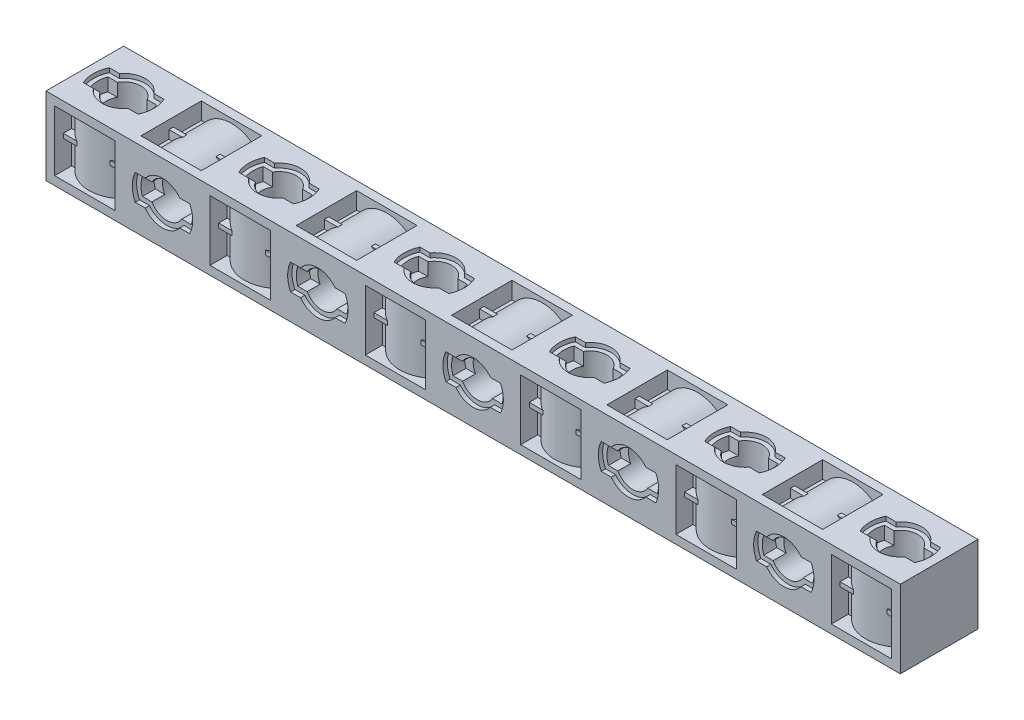
from build123d import *

# Parameters (mm, degrees)
SKETCH1_W                 = 99
SKETCH1_H                 = 9
BOSS_EXTRUDE1_DEPTH       = 4.5
SKETCH4_R                 = 2
CUT_EXTRUDE1_DEPTH        = 50.907414279
CUT_EXTRUDE2_DEPTH        = 2
CUT_EXTRUDE3_DEPTH        = 0.5
SKETCH8_R                 = 2
CUT_EXTRUDE4_DEPTH        = 50.907414279
CUT_EXTRUDE5_DEPTH        = 2
CUT_EXTRUDE6_DEPTH        = 0.5
SKETCH_PATTERN1_START     = -5
SKETCH_PATTERN1_OUTLINE_R = 2
SKETCH_PATTERN1_DEPTH     = 10
SKETCH_PATTERN1_2_DEPTH   = 2.5
SKETCH_PATTERN1_START_2   = 2.5
SKETCH_PATTERN1_3_DEPTH   = 2.5
SKETCH_PATTERN1_4_DEPTH   = 1
SKETCH_PATTERN1_START_3   = 4
SKETCH_PATTERN1_5_DEPTH   = 1
SKETCH_PATTERN2_START     = -4.5
SKETCH_PATTERN2_OUTLINE_R = 2
SKETCH_PATTERN2_DEPTH     = 9
SKETCH_PATTERN2_2_DEPTH   = 2
SKETCH_PATTERN2_START_2   = 2.5
SKETCH_PATTERN2_3_DEPTH   = 2
SKETCH_PATTERN2_4_DEPTH   = 0.5
SKETCH_PATTERN2_START_3   = 4
SKETCH_PATTERN2_5_DEPTH   = 0.5
CUT_EXTRUDE7_DEPTH        = 3.5
CUT_EXTRUDE8_DEPTH        = 3.5
RIB3_START                = -0.972155068
RIB3_OUTLINE_W            = 7
RIB3_OUTLINE_H            = 0.5
RIB3_DEPTH                = 0.972155068
SKETCH_PATTERN13_START    = -0.25
SKETCH_PATTERN13_DEPTH    = 0.5
RIB5_START                = -0.972155068
RIB5_OUTLINE_W            = 7
RIB5_OUTLINE_H            = 0.5
RIB5_DEPTH                = 0.972155068
SKETCH_PATTERN16_START    = -0.25
SKETCH_PATTERN16_DEPTH    = 0.5


with BuildPart() as part:
    # Sketch1 → Boss-Extrude1 (new, symmetric)
    with BuildSketch(Plane(origin=(0, 0, 0), x_dir=(1, 0, 0), z_dir=(0, 1, 0))):
        Rectangle(SKETCH1_W, SKETCH1_H)
    extrude(amount=BOSS_EXTRUDE1_DEPTH, both=True)

    # Sketch4 → Cut-Extrude1 (cut, symmetric)
    with BuildSketch(Plane(origin=(0, 0, 0), x_dir=(1, 0, 0), z_dir=(0, 1, 0))):
        with Locations(Location((-45, 0, 0), (0, 0, 270))):
            Circle(SKETCH4_R)
    extrude(amount=CUT_EXTRUDE1_DEPTH, both=True, mode=Mode.SUBTRACT)

    # Sketch5 → Cut-Extrude2 (cut)
    with BuildSketch(Plane(origin=(0, 4.5, 0), x_dir=(1, 0, 0), z_dir=(0, 1, 0))):
        with BuildLine():
            ThreePointArc((-48, 0), (-47.956795679, -0.507305936), (-47.828427125, -1))
            Line((-47.828427125, -1), (-46.732050808, -1))
            ThreePointArc((-46.732050808, -1), (-47, 0), (-46.732050808, 1))
            Line((-46.732050808, 1), (-47.828427125, 1))
            ThreePointArc((-47.828427125, 1), (-47.956795679, 0.507305936), (-48, 0))
        make_face()
        with BuildLine():
            Line((-43.267949192, -1), (-42.171572875, -1))
            ThreePointArc((-42.171572875, -1), (-42.043204321, -0.507305936), (-42, 0))
            ThreePointArc((-42, 0), (-42.043204321, 0.507305936), (-42.171572875, 1))
            Line((-42.171572875, 1), (-43.267949192, 1))
            ThreePointArc((-43.267949192, 1), (-43.068148347, 0.51763809), (-43, 0))
            ThreePointArc((-43, 0), (-43.068148347, -0.51763809), (-43.267949192, -1))
        make_face()
        with BuildLine():
            ThreePointArc((-46.732050808, 1), (-47, 0), (-46.732050808, -1))
            Line((-46.732050808, -1), (-43.267949192, -1))
            ThreePointArc((-43.267949192, -1), (-43.068148347, -0.51763809), (-43, 0))
            ThreePointArc((-43, 0), (-43.068148347, 0.51763809), (-43.267949192, 1))
            Line((-43.267949192, 1), (-46.732050808, 1))
        make_face()
    cut_extrude2 = extrude(amount=-CUT_EXTRUDE2_DEPTH, mode=Mode.SUBTRACT)

    # Sketch6 → Cut-Extrude3 (cut)
    with BuildSketch(Plane(origin=(0, 4.5, 0), x_dir=(1, 0, 0), z_dir=(0, 1, 0))):
        with BuildLine():
            Line((-48.16227766, 1.5), (-47, 1.5))
            ThreePointArc((-47, 1.5), (-45, 2.5), (-43, 1.5))
            Line((-43, 1.5), (-41.83772234, 1.5))
            ThreePointArc((-41.83772234, 1.5), (-41.5, 0), (-41.83772234, -1.5))
            Line((-41.83772234, -1.5), (-43, -1.5))
            ThreePointArc((-43, -1.5), (-45, -2.5), (-47, -1.5))
            Line((-47, -1.5), (-48.16227766, -1.5))
            ThreePointArc((-48.16227766, -1.5), (-48.5, 0), (-48.16227766, 1.5))
        make_face()
        with BuildLine():
            Line((-43.267949192, -1), (-42.171572875, -1))
            ThreePointArc((-42.171572875, -1), (-42, 0), (-42.171572875, 1))
            Line((-42.171572875, 1), (-43.267949192, 1))
            ThreePointArc((-43.267949192, 1), (-45, 2), (-46.732050808, 1))
            Line((-46.732050808, 1), (-47.828427125, 1))
            ThreePointArc((-47.828427125, 1), (-48, 0), (-47.828427125, -1))
            Line((-47.828427125, -1), (-46.732050808, -1))
            ThreePointArc((-46.732050808, -1), (-45, -2), (-43.267949192, -1))
        make_face(mode=Mode.SUBTRACT)
    cut_extrude3 = extrude(amount=-CUT_EXTRUDE3_DEPTH, mode=Mode.SUBTRACT)

    # Mirror1: Cut-Extrude2, Cut-Extrude3 across plane
    add(cut_extrude2.mirror(Plane.ZX), mode=Mode.SUBTRACT)
    add(cut_extrude3.mirror(Plane.ZX), mode=Mode.SUBTRACT)

    # Sketch8 → Cut-Extrude4 (cut, symmetric)
    with BuildSketch(Plane.XY):
        with Locations((-36, 0)):
            Circle(SKETCH8_R)
    extrude(amount=CUT_EXTRUDE4_DEPTH, both=True, mode=Mode.SUBTRACT)

    # Sketch9 → Cut-Extrude5 (cut)
    with BuildSketch(Plane.XY.offset(4.5)):
        with BuildLine():
            ThreePointArc((-39, 0), (-38.956795679, -0.507305936), (-38.828427125, -1))
            Line((-38.828427125, -1), (-37.732050808, -1))
            ThreePointArc((-37.732050808, -1), (-38, 0), (-37.732050808, 1))
            Line((-37.732050808, 1), (-38.828427125, 1))
            ThreePointArc((-38.828427125, 1), (-38.956795679, 0.507305936), (-39, 0))
        make_face()
        with BuildLine():
            Line((-34.267949192, -1), (-33.171572875, -1))
            ThreePointArc((-33.171572875, -1), (-33.043204321, -0.507305936), (-33, 0))
            ThreePointArc((-33, 0), (-33.043204321, 0.507305936), (-33.171572875, 1))
            Line((-33.171572875, 1), (-34.267949192, 1))
            ThreePointArc((-34.267949192, 1), (-34.068148347, 0.51763809), (-34, 0))
            ThreePointArc((-34, 0), (-34.068148347, -0.51763809), (-34.267949192, -1))
        make_face()
        with BuildLine():
            ThreePointArc((-37.732050808, 1), (-38, 0), (-37.732050808, -1))
            Line((-37.732050808, -1), (-34.267949192, -1))
            ThreePointArc((-34.267949192, -1), (-34.068148347, -0.51763809), (-34, 0))
            ThreePointArc((-34, 0), (-34.068148347, 0.51763809), (-34.267949192, 1))
            Line((-34.267949192, 1), (-37.732050808, 1))
        make_face()
    cut_extrude5 = extrude(amount=-CUT_EXTRUDE5_DEPTH, mode=Mode.SUBTRACT)

    # Sketch10 → Cut-Extrude6 (cut)
    with BuildSketch(Plane.XY.offset(4.5)):
        with BuildLine():
            Line((-39.16227766, 1.5), (-38, 1.5))
            ThreePointArc((-38, 1.5), (-36, 2.5), (-34, 1.5))
            Line((-34, 1.5), (-32.83772234, 1.5))
            ThreePointArc((-32.83772234, 1.5), (-32.5, 0), (-32.83772234, -1.5))
            Line((-32.83772234, -1.5), (-34, -1.5))
            ThreePointArc((-34, -1.5), (-36, -2.5), (-38, -1.5))
            Line((-38, -1.5), (-39.16227766, -1.5))
            ThreePointArc((-39.16227766, -1.5), (-39.5, 0), (-39.16227766, 1.5))
        make_face()
        with BuildLine():
            Line((-34.267949192, -1), (-33.171572875, -1))
            ThreePointArc((-33.171572875, -1), (-33, 0), (-33.171572875, 1))
            Line((-33.171572875, 1), (-34.267949192, 1))
            ThreePointArc((-34.267949192, 1), (-36, 2), (-37.732050808, 1))
            Line((-37.732050808, 1), (-38.828427125, 1))
            ThreePointArc((-38.828427125, 1), (-39, 0), (-38.828427125, -1))
            Line((-38.828427125, -1), (-37.732050808, -1))
            ThreePointArc((-37.732050808, -1), (-36, -2), (-34.267949192, -1))
        make_face(mode=Mode.SUBTRACT)
    cut_extrude6 = extrude(amount=-CUT_EXTRUDE6_DEPTH, mode=Mode.SUBTRACT)

    # Mirror2: Cut-Extrude5, Cut-Extrude6 across plane
    add(cut_extrude5.mirror(Plane.XY), mode=Mode.SUBTRACT)
    add(cut_extrude6.mirror(Plane.XY), mode=Mode.SUBTRACT)

    # Sketch-Pattern1: read off the stored shape, not the designer's step
    # Sketch-Pattern1 outline → Sketch-Pattern1 (cut)
    with BuildSketch(Plane(origin=(0, 0, 0), x_dir=(1, 0, 0), z_dir=(0, 1, 0)).offset(SKETCH_PATTERN1_START)):
        with Locations((45, 0)):
            Circle(SKETCH_PATTERN1_OUTLINE_R)
        with Locations((27, 0)):
            Circle(SKETCH_PATTERN1_OUTLINE_R)
        with Locations((9, 0)):
            Circle(SKETCH_PATTERN1_OUTLINE_R)
        with Locations((-9, 0)):
            Circle(SKETCH_PATTERN1_OUTLINE_R)
        with Locations((-27, 0)):
            Circle(SKETCH_PATTERN1_OUTLINE_R)
    extrude(amount=SKETCH_PATTERN1_DEPTH, mode=Mode.SUBTRACT)

    # Sketch-Pattern1 2 outline → Sketch-Pattern1 2 (cut)
    with BuildSketch(Plane(origin=(0, 0, 0), x_dir=(1, 0, 0), z_dir=(0, 1, 0)).offset(SKETCH_PATTERN1_START)):
        with BuildLine():
            ThreePointArc((46.732050808, 1), (47, 0), (46.732050808, -1))
            Line((46.732050808, -1), (47.828427125, -1))
            ThreePointArc((47.828427125, -1), (48, 0), (47.828427125, 1))
            Line((47.828427125, 1), (46.732050808, 1))
        make_face()
        with BuildLine():
            ThreePointArc((43.267949192, -1), (43, 0), (43.267949192, 1))
            Line((43.267949192, 1), (42.171572875, 1))
            ThreePointArc((42.171572875, 1), (42, 0), (42.171572875, -1))
            Line((42.171572875, -1), (43.267949192, -1))
        make_face()
        with BuildLine():
            ThreePointArc((28.732050808, 1), (29, 0), (28.732050808, -1))
            Line((28.732050808, -1), (29.828427125, -1))
            ThreePointArc((29.828427125, -1), (30, 0), (29.828427125, 1))
            Line((29.828427125, 1), (28.732050808, 1))
        make_face()
        with BuildLine():
            ThreePointArc((25.267949192, -1), (25, 0), (25.267949192, 1))
            Line((25.267949192, 1), (24.171572875, 1))
            ThreePointArc((24.171572875, 1), (24, 0), (24.171572875, -1))
            Line((24.171572875, -1), (25.267949192, -1))
        make_face()
        with BuildLine():
            ThreePointArc((10.732050808, 1), (11, 0), (10.732050808, -1))
            Line((10.732050808, -1), (11.828427125, -1))
            ThreePointArc((11.828427125, -1), (12, 0), (11.828427125, 1))
            Line((11.828427125, 1), (10.732050808, 1))
        make_face()
        with BuildLine():
            ThreePointArc((7.267949192, -1), (7, 0), (7.267949192, 1))
            Line((7.267949192, 1), (6.171572875, 1))
            ThreePointArc((6.171572875, 1), (6, 0), (6.171572875, -1))
            Line((6.171572875, -1), (7.267949192, -1))
        make_face()
        with BuildLine():
            ThreePointArc((-7.267949192, 1), (-7, 0), (-7.267949192, -1))
            Line((-7.267949192, -1), (-6.171572875, -1))
            ThreePointArc((-6.171572875, -1), (-6, 0), (-6.171572875, 1))
            Line((-6.171572875, 1), (-7.267949192, 1))
        make_face()
        with BuildLine():
            ThreePointArc((-10.732050808, -1), (-11, 0), (-10.732050808, 1))
            Line((-10.732050808, 1), (-11.828427125, 1))
            ThreePointArc((-11.828427125, 1), (-12, 0), (-11.828427125, -1))
            Line((-11.828427125, -1), (-10.732050808, -1))
        make_face()
        with BuildLine():
            ThreePointArc((-25.267949192, 1), (-25, 0), (-25.267949192, -1))
            Line((-25.267949192, -1), (-24.171572875, -1))
            ThreePointArc((-24.171572875, -1), (-24, 0), (-24.171572875, 1))
            Line((-24.171572875, 1), (-25.267949192, 1))
        make_face()
        with BuildLine():
            ThreePointArc((-28.732050808, -1), (-29, 0), (-28.732050808, 1))
            Line((-28.732050808, 1), (-29.828427125, 1))
            ThreePointArc((-29.828427125, 1), (-30, 0), (-29.828427125, -1))
            Line((-29.828427125, -1), (-28.732050808, -1))
        make_face()
    extrude(amount=SKETCH_PATTERN1_2_DEPTH, mode=Mode.SUBTRACT)

    # Sketch-Pattern1 3 outline → Sketch-Pattern1 3 (cut)
    with BuildSketch(Plane(origin=(0, 0, 0), x_dir=(1, 0, 0), z_dir=(0, 1, 0)).offset(SKETCH_PATTERN1_START_2)):
        with BuildLine():
            ThreePointArc((46.732050808, 1), (47, 0), (46.732050808, -1))
            Line((46.732050808, -1), (47.828427125, -1))
            ThreePointArc((47.828427125, -1), (48, 0), (47.828427125, 1))
            Line((47.828427125, 1), (46.732050808, 1))
        make_face()
        with BuildLine():
            ThreePointArc((43.267949192, -1), (43, 0), (43.267949192, 1))
            Line((43.267949192, 1), (42.171572875, 1))
            ThreePointArc((42.171572875, 1), (42, 0), (42.171572875, -1))
            Line((42.171572875, -1), (43.267949192, -1))
        make_face()
        with BuildLine():
            ThreePointArc((28.732050808, 1), (29, 0), (28.732050808, -1))
            Line((28.732050808, -1), (29.828427125, -1))
            ThreePointArc((29.828427125, -1), (30, 0), (29.828427125, 1))
            Line((29.828427125, 1), (28.732050808, 1))
        make_face()
        with BuildLine():
            ThreePointArc((25.267949192, -1), (25, 0), (25.267949192, 1))
            Line((25.267949192, 1), (24.171572875, 1))
            ThreePointArc((24.171572875, 1), (24, 0), (24.171572875, -1))
            Line((24.171572875, -1), (25.267949192, -1))
        make_face()
        with BuildLine():
            ThreePointArc((10.732050808, 1), (11, 0), (10.732050808, -1))
            Line((10.732050808, -1), (11.828427125, -1))
            ThreePointArc((11.828427125, -1), (12, 0), (11.828427125, 1))
            Line((11.828427125, 1), (10.732050808, 1))
        make_face()
        with BuildLine():
            ThreePointArc((7.267949192, -1), (7, 0), (7.267949192, 1))
            Line((7.267949192, 1), (6.171572875, 1))
            ThreePointArc((6.171572875, 1), (6, 0), (6.171572875, -1))
            Line((6.171572875, -1), (7.267949192, -1))
        make_face()
        with BuildLine():
            ThreePointArc((-7.267949192, 1), (-7, 0), (-7.267949192, -1))
            Line((-7.267949192, -1), (-6.171572875, -1))
            ThreePointArc((-6.171572875, -1), (-6, 0), (-6.171572875, 1))
            Line((-6.171572875, 1), (-7.267949192, 1))
        make_face()
        with BuildLine():
            ThreePointArc((-10.732050808, -1), (-11, 0), (-10.732050808, 1))
            Line((-10.732050808, 1), (-11.828427125, 1))
            ThreePointArc((-11.828427125, 1), (-12, 0), (-11.828427125, -1))
            Line((-11.828427125, -1), (-10.732050808, -1))
        make_face()
        with BuildLine():
            ThreePointArc((-25.267949192, 1), (-25, 0), (-25.267949192, -1))
            Line((-25.267949192, -1), (-24.171572875, -1))
            ThreePointArc((-24.171572875, -1), (-24, 0), (-24.171572875, 1))
            Line((-24.171572875, 1), (-25.267949192, 1))
        make_face()
        with BuildLine():
            ThreePointArc((-28.732050808, -1), (-29, 0), (-28.732050808, 1))
            Line((-28.732050808, 1), (-29.828427125, 1))
            ThreePointArc((-29.828427125, 1), (-30, 0), (-29.828427125, -1))
            Line((-29.828427125, -1), (-28.732050808, -1))
        make_face()
    extrude(amount=SKETCH_PATTERN1_3_DEPTH, mode=Mode.SUBTRACT)

    # Sketch-Pattern1 4 outline → Sketch-Pattern1 4 (cut)
    # profile 1 of 5: a face of its own
    with BuildSketch(Plane(origin=(0, 0, 0), x_dir=(1, 0, 0), z_dir=(0, 1, 0)).offset(SKETCH_PATTERN1_START)):
        with BuildLine():
            Line((-29, 1.5), (-30.16227766, 1.5))
            ThreePointArc((-30.16227766, 1.5), (-30.5, 0), (-30.16227766, -1.5))
            Line((-30.16227766, -1.5), (-29, -1.5))
            ThreePointArc((-29, -1.5), (-27, -2.5), (-25, -1.5))
            Line((-25, -1.5), (-23.83772234, -1.5))
            ThreePointArc((-23.83772234, -1.5), (-23.5, 0), (-23.83772234, 1.5))
            Line((-23.83772234, 1.5), (-25, 1.5))
            ThreePointArc((-25, 1.5), (-27, 2.5), (-29, 1.5))
        make_face()
        with BuildLine():
            ThreePointArc((-28.732050808, 1), (-27, 2), (-25.267949192, 1))
            Line((-25.267949192, 1), (-24.171572875, 1))
            ThreePointArc((-24.171572875, 1), (-24, 0), (-24.171572875, -1))
            Line((-24.171572875, -1), (-25.267949192, -1))
            ThreePointArc((-25.267949192, -1), (-27, -2), (-28.732050808, -1))
            Line((-28.732050808, -1), (-29.828427125, -1))
            ThreePointArc((-29.828427125, -1), (-30, 0), (-29.828427125, 1))
            Line((-29.828427125, 1), (-28.732050808, 1))
        make_face(mode=Mode.SUBTRACT)
    # profile 2 of 5: a face of its own
    with BuildSketch(Plane(origin=(0, 0, 0), x_dir=(1, 0, 0), z_dir=(0, 1, 0)).offset(SKETCH_PATTERN1_START)):
        with BuildLine():
            Line((-11, 1.5), (-12.16227766, 1.5))
            ThreePointArc((-12.16227766, 1.5), (-12.5, 0), (-12.16227766, -1.5))
            Line((-12.16227766, -1.5), (-11, -1.5))
            ThreePointArc((-11, -1.5), (-9, -2.5), (-7, -1.5))
            Line((-7, -1.5), (-5.83772234, -1.5))
            ThreePointArc((-5.83772234, -1.5), (-5.5, 0), (-5.83772234, 1.5))
            Line((-5.83772234, 1.5), (-7, 1.5))
            ThreePointArc((-7, 1.5), (-9, 2.5), (-11, 1.5))
        make_face()
        with BuildLine():
            ThreePointArc((-10.732050808, 1), (-9, 2), (-7.267949192, 1))
            Line((-7.267949192, 1), (-6.171572875, 1))
            ThreePointArc((-6.171572875, 1), (-6, 0), (-6.171572875, -1))
            Line((-6.171572875, -1), (-7.267949192, -1))
            ThreePointArc((-7.267949192, -1), (-9, -2), (-10.732050808, -1))
            Line((-10.732050808, -1), (-11.828427125, -1))
            ThreePointArc((-11.828427125, -1), (-12, 0), (-11.828427125, 1))
            Line((-11.828427125, 1), (-10.732050808, 1))
        make_face(mode=Mode.SUBTRACT)
    # profile 3 of 5: a face of its own
    with BuildSketch(Plane(origin=(0, 0, 0), x_dir=(1, 0, 0), z_dir=(0, 1, 0)).offset(SKETCH_PATTERN1_START)):
        with BuildLine():
            Line((7, 1.5), (5.83772234, 1.5))
            ThreePointArc((5.83772234, 1.5), (5.5, 0), (5.83772234, -1.5))
            Line((5.83772234, -1.5), (7, -1.5))
            ThreePointArc((7, -1.5), (9, -2.5), (11, -1.5))
            Line((11, -1.5), (12.16227766, -1.5))
            ThreePointArc((12.16227766, -1.5), (12.5, 0), (12.16227766, 1.5))
            Line((12.16227766, 1.5), (11, 1.5))
            ThreePointArc((11, 1.5), (9, 2.5), (7, 1.5))
        make_face()
        with BuildLine():
            ThreePointArc((7.267949192, 1), (9, 2), (10.732050808, 1))
            Line((10.732050808, 1), (11.828427125, 1))
            ThreePointArc((11.828427125, 1), (12, 0), (11.828427125, -1))
            Line((11.828427125, -1), (10.732050808, -1))
            ThreePointArc((10.732050808, -1), (9, -2), (7.267949192, -1))
            Line((7.267949192, -1), (6.171572875, -1))
            ThreePointArc((6.171572875, -1), (6, 0), (6.171572875, 1))
            Line((6.171572875, 1), (7.267949192, 1))
        make_face(mode=Mode.SUBTRACT)
    # profile 4 of 5: a face of its own
    with BuildSketch(Plane(origin=(0, 0, 0), x_dir=(1, 0, 0), z_dir=(0, 1, 0)).offset(SKETCH_PATTERN1_START)):
        with BuildLine():
            Line((25, 1.5), (23.83772234, 1.5))
            ThreePointArc((23.83772234, 1.5), (23.5, 0), (23.83772234, -1.5))
            Line((23.83772234, -1.5), (25, -1.5))
            ThreePointArc((25, -1.5), (27, -2.5), (29, -1.5))
            Line((29, -1.5), (30.16227766, -1.5))
            ThreePointArc((30.16227766, -1.5), (30.5, 0), (30.16227766, 1.5))
            Line((30.16227766, 1.5), (29, 1.5))
            ThreePointArc((29, 1.5), (27, 2.5), (25, 1.5))
        make_face()
        with BuildLine():
            ThreePointArc((25.267949192, 1), (27, 2), (28.732050808, 1))
            Line((28.732050808, 1), (29.828427125, 1))
            ThreePointArc((29.828427125, 1), (30, 0), (29.828427125, -1))
            Line((29.828427125, -1), (28.732050808, -1))
            ThreePointArc((28.732050808, -1), (27, -2), (25.267949192, -1))
            Line((25.267949192, -1), (24.171572875, -1))
            ThreePointArc((24.171572875, -1), (24, 0), (24.171572875, 1))
            Line((24.171572875, 1), (25.267949192, 1))
        make_face(mode=Mode.SUBTRACT)
    # profile 5 of 5: a face of its own
    with BuildSketch(Plane(origin=(0, 0, 0), x_dir=(1, 0, 0), z_dir=(0, 1, 0)).offset(SKETCH_PATTERN1_START)):
        with BuildLine():
            Line((43, 1.5), (41.83772234, 1.5))
            ThreePointArc((41.83772234, 1.5), (41.5, 0), (41.83772234, -1.5))
            Line((41.83772234, -1.5), (43, -1.5))
            ThreePointArc((43, -1.5), (45, -2.5), (47, -1.5))
            Line((47, -1.5), (48.16227766, -1.5))
            ThreePointArc((48.16227766, -1.5), (48.5, 0), (48.16227766, 1.5))
            Line((48.16227766, 1.5), (47, 1.5))
            ThreePointArc((47, 1.5), (45, 2.5), (43, 1.5))
        make_face()
        with BuildLine():
            ThreePointArc((43.267949192, 1), (45, 2), (46.732050808, 1))
            Line((46.732050808, 1), (47.828427125, 1))
            ThreePointArc((47.828427125, 1), (48, 0), (47.828427125, -1))
            Line((47.828427125, -1), (46.732050808, -1))
            ThreePointArc((46.732050808, -1), (45, -2), (43.267949192, -1))
            Line((43.267949192, -1), (42.171572875, -1))
            ThreePointArc((42.171572875, -1), (42, 0), (42.171572875, 1))
            Line((42.171572875, 1), (43.267949192, 1))
        make_face(mode=Mode.SUBTRACT)
    extrude(amount=SKETCH_PATTERN1_4_DEPTH, mode=Mode.SUBTRACT)

    # Sketch-Pattern1 5 outline → Sketch-Pattern1 5 (cut)
    # profile 1 of 5: a face of its own
    with BuildSketch(Plane(origin=(0, 0, 0), x_dir=(1, 0, 0), z_dir=(0, 1, 0)).offset(SKETCH_PATTERN1_START_3)):
        with BuildLine():
            Line((-29, 1.5), (-30.16227766, 1.5))
            ThreePointArc((-30.16227766, 1.5), (-30.5, 0), (-30.16227766, -1.5))
            Line((-30.16227766, -1.5), (-29, -1.5))
            ThreePointArc((-29, -1.5), (-27, -2.5), (-25, -1.5))
            Line((-25, -1.5), (-23.83772234, -1.5))
            ThreePointArc((-23.83772234, -1.5), (-23.5, 0), (-23.83772234, 1.5))
            Line((-23.83772234, 1.5), (-25, 1.5))
            ThreePointArc((-25, 1.5), (-27, 2.5), (-29, 1.5))
        make_face()
        with BuildLine():
            ThreePointArc((-28.732050808, 1), (-27, 2), (-25.267949192, 1))
            Line((-25.267949192, 1), (-24.171572875, 1))
            ThreePointArc((-24.171572875, 1), (-24, 0), (-24.171572875, -1))
            Line((-24.171572875, -1), (-25.267949192, -1))
            ThreePointArc((-25.267949192, -1), (-27, -2), (-28.732050808, -1))
            Line((-28.732050808, -1), (-29.828427125, -1))
            ThreePointArc((-29.828427125, -1), (-30, 0), (-29.828427125, 1))
            Line((-29.828427125, 1), (-28.732050808, 1))
        make_face(mode=Mode.SUBTRACT)
    # profile 2 of 5: a face of its own
    with BuildSketch(Plane(origin=(0, 0, 0), x_dir=(1, 0, 0), z_dir=(0, 1, 0)).offset(SKETCH_PATTERN1_START_3)):
        with BuildLine():
            Line((-11, 1.5), (-12.16227766, 1.5))
            ThreePointArc((-12.16227766, 1.5), (-12.5, 0), (-12.16227766, -1.5))
            Line((-12.16227766, -1.5), (-11, -1.5))
            ThreePointArc((-11, -1.5), (-9, -2.5), (-7, -1.5))
            Line((-7, -1.5), (-5.83772234, -1.5))
            ThreePointArc((-5.83772234, -1.5), (-5.5, 0), (-5.83772234, 1.5))
            Line((-5.83772234, 1.5), (-7, 1.5))
            ThreePointArc((-7, 1.5), (-9, 2.5), (-11, 1.5))
        make_face()
        with BuildLine():
            ThreePointArc((-10.732050808, 1), (-9, 2), (-7.267949192, 1))
            Line((-7.267949192, 1), (-6.171572875, 1))
            ThreePointArc((-6.171572875, 1), (-6, 0), (-6.171572875, -1))
            Line((-6.171572875, -1), (-7.267949192, -1))
            ThreePointArc((-7.267949192, -1), (-9, -2), (-10.732050808, -1))
            Line((-10.732050808, -1), (-11.828427125, -1))
            ThreePointArc((-11.828427125, -1), (-12, 0), (-11.828427125, 1))
            Line((-11.828427125, 1), (-10.732050808, 1))
        make_face(mode=Mode.SUBTRACT)
    # profile 3 of 5: a face of its own
    with BuildSketch(Plane(origin=(0, 0, 0), x_dir=(1, 0, 0), z_dir=(0, 1, 0)).offset(SKETCH_PATTERN1_START_3)):
        with BuildLine():
            Line((7, 1.5), (5.83772234, 1.5))
            ThreePointArc((5.83772234, 1.5), (5.5, 0), (5.83772234, -1.5))
            Line((5.83772234, -1.5), (7, -1.5))
            ThreePointArc((7, -1.5), (9, -2.5), (11, -1.5))
            Line((11, -1.5), (12.16227766, -1.5))
            ThreePointArc((12.16227766, -1.5), (12.5, 0), (12.16227766, 1.5))
            Line((12.16227766, 1.5), (11, 1.5))
            ThreePointArc((11, 1.5), (9, 2.5), (7, 1.5))
        make_face()
        with BuildLine():
            ThreePointArc((7.267949192, 1), (9, 2), (10.732050808, 1))
            Line((10.732050808, 1), (11.828427125, 1))
            ThreePointArc((11.828427125, 1), (12, 0), (11.828427125, -1))
            Line((11.828427125, -1), (10.732050808, -1))
            ThreePointArc((10.732050808, -1), (9, -2), (7.267949192, -1))
            Line((7.267949192, -1), (6.171572875, -1))
            ThreePointArc((6.171572875, -1), (6, 0), (6.171572875, 1))
            Line((6.171572875, 1), (7.267949192, 1))
        make_face(mode=Mode.SUBTRACT)
    # profile 4 of 5: a face of its own
    with BuildSketch(Plane(origin=(0, 0, 0), x_dir=(1, 0, 0), z_dir=(0, 1, 0)).offset(SKETCH_PATTERN1_START_3)):
        with BuildLine():
            Line((25, 1.5), (23.83772234, 1.5))
            ThreePointArc((23.83772234, 1.5), (23.5, 0), (23.83772234, -1.5))
            Line((23.83772234, -1.5), (25, -1.5))
            ThreePointArc((25, -1.5), (27, -2.5), (29, -1.5))
            Line((29, -1.5), (30.16227766, -1.5))
            ThreePointArc((30.16227766, -1.5), (30.5, 0), (30.16227766, 1.5))
            Line((30.16227766, 1.5), (29, 1.5))
            ThreePointArc((29, 1.5), (27, 2.5), (25, 1.5))
        make_face()
        with BuildLine():
            ThreePointArc((25.267949192, 1), (27, 2), (28.732050808, 1))
            Line((28.732050808, 1), (29.828427125, 1))
            ThreePointArc((29.828427125, 1), (30, 0), (29.828427125, -1))
            Line((29.828427125, -1), (28.732050808, -1))
            ThreePointArc((28.732050808, -1), (27, -2), (25.267949192, -1))
            Line((25.267949192, -1), (24.171572875, -1))
            ThreePointArc((24.171572875, -1), (24, 0), (24.171572875, 1))
            Line((24.171572875, 1), (25.267949192, 1))
        make_face(mode=Mode.SUBTRACT)
    # profile 5 of 5: a face of its own
    with BuildSketch(Plane(origin=(0, 0, 0), x_dir=(1, 0, 0), z_dir=(0, 1, 0)).offset(SKETCH_PATTERN1_START_3)):
        with BuildLine():
            Line((43, 1.5), (41.83772234, 1.5))
            ThreePointArc((41.83772234, 1.5), (41.5, 0), (41.83772234, -1.5))
            Line((41.83772234, -1.5), (43, -1.5))
            ThreePointArc((43, -1.5), (45, -2.5), (47, -1.5))
            Line((47, -1.5), (48.16227766, -1.5))
            ThreePointArc((48.16227766, -1.5), (48.5, 0), (48.16227766, 1.5))
            Line((48.16227766, 1.5), (47, 1.5))
            ThreePointArc((47, 1.5), (45, 2.5), (43, 1.5))
        make_face()
        with BuildLine():
            ThreePointArc((43.267949192, 1), (45, 2), (46.732050808, 1))
            Line((46.732050808, 1), (47.828427125, 1))
            ThreePointArc((47.828427125, 1), (48, 0), (47.828427125, -1))
            Line((47.828427125, -1), (46.732050808, -1))
            ThreePointArc((46.732050808, -1), (45, -2), (43.267949192, -1))
            Line((43.267949192, -1), (42.171572875, -1))
            ThreePointArc((42.171572875, -1), (42, 0), (42.171572875, 1))
            Line((42.171572875, 1), (43.267949192, 1))
        make_face(mode=Mode.SUBTRACT)
    extrude(amount=SKETCH_PATTERN1_5_DEPTH, mode=Mode.SUBTRACT)

    # Sketch-Pattern2: read off the stored shape, not the designer's step
    # Sketch-Pattern2 outline → Sketch-Pattern2 (cut)
    with BuildSketch(Plane.XY.offset(SKETCH_PATTERN2_START)):
        with Locations((36, 0)):
            Circle(SKETCH_PATTERN2_OUTLINE_R)
        with Locations((18, 0)):
            Circle(SKETCH_PATTERN2_OUTLINE_R)
        Circle(SKETCH_PATTERN2_OUTLINE_R)
        with Locations((-18, 0)):
            Circle(SKETCH_PATTERN2_OUTLINE_R)
    extrude(amount=SKETCH_PATTERN2_DEPTH, mode=Mode.SUBTRACT)

    # Sketch-Pattern2 2 outline → Sketch-Pattern2 2 (cut)
    with BuildSketch(Plane.XY.offset(SKETCH_PATTERN2_START)):
        with BuildLine():
            ThreePointArc((37.732050808, 1), (38, 0), (37.732050808, -1))
            Line((37.732050808, -1), (38.828427125, -1))
            ThreePointArc((38.828427125, -1), (39, 0), (38.828427125, 1))
            Line((38.828427125, 1), (37.732050808, 1))
        make_face()
        with BuildLine():
            ThreePointArc((34.267949192, -1), (34, 0), (34.267949192, 1))
            Line((34.267949192, 1), (33.171572875, 1))
            ThreePointArc((33.171572875, 1), (33, 0), (33.171572875, -1))
            Line((33.171572875, -1), (34.267949192, -1))
        make_face()
        with BuildLine():
            ThreePointArc((19.732050808, 1), (20, 0), (19.732050808, -1))
            Line((19.732050808, -1), (20.828427125, -1))
            ThreePointArc((20.828427125, -1), (21, 0), (20.828427125, 1))
            Line((20.828427125, 1), (19.732050808, 1))
        make_face()
        with BuildLine():
            ThreePointArc((16.267949192, -1), (16, 0), (16.267949192, 1))
            Line((16.267949192, 1), (15.171572875, 1))
            ThreePointArc((15.171572875, 1), (15, 0), (15.171572875, -1))
            Line((15.171572875, -1), (16.267949192, -1))
        make_face()
        with BuildLine():
            ThreePointArc((1.732050808, 1), (2, 0), (1.732050808, -1))
            Line((1.732050808, -1), (2.828427125, -1))
            ThreePointArc((2.828427125, -1), (3, 0), (2.828427125, 1))
            Line((2.828427125, 1), (1.732050808, 1))
        make_face()
        with BuildLine():
            ThreePointArc((-1.732050808, -1), (-2, 0), (-1.732050808, 1))
            Line((-1.732050808, 1), (-2.828427125, 1))
            ThreePointArc((-2.828427125, 1), (-3, 0), (-2.828427125, -1))
            Line((-2.828427125, -1), (-1.732050808, -1))
        make_face()
        with BuildLine():
            ThreePointArc((-16.267949192, 1), (-16, 0), (-16.267949192, -1))
            Line((-16.267949192, -1), (-15.171572875, -1))
            ThreePointArc((-15.171572875, -1), (-15, 0), (-15.171572875, 1))
            Line((-15.171572875, 1), (-16.267949192, 1))
        make_face()
        with BuildLine():
            ThreePointArc((-19.732050808, -1), (-20, 0), (-19.732050808, 1))
            Line((-19.732050808, 1), (-20.828427125, 1))
            ThreePointArc((-20.828427125, 1), (-21, 0), (-20.828427125, -1))
            Line((-20.828427125, -1), (-19.732050808, -1))
        make_face()
    extrude(amount=SKETCH_PATTERN2_2_DEPTH, mode=Mode.SUBTRACT)

    # Sketch-Pattern2 3 outline → Sketch-Pattern2 3 (cut)
    with BuildSketch(Plane.XY.offset(SKETCH_PATTERN2_START_2)):
        with BuildLine():
            ThreePointArc((37.732050808, 1), (38, 0), (37.732050808, -1))
            Line((37.732050808, -1), (38.828427125, -1))
            ThreePointArc((38.828427125, -1), (39, 0), (38.828427125, 1))
            Line((38.828427125, 1), (37.732050808, 1))
        make_face()
        with BuildLine():
            ThreePointArc((34.267949192, -1), (34, 0), (34.267949192, 1))
            Line((34.267949192, 1), (33.171572875, 1))
            ThreePointArc((33.171572875, 1), (33, 0), (33.171572875, -1))
            Line((33.171572875, -1), (34.267949192, -1))
        make_face()
        with BuildLine():
            ThreePointArc((19.732050808, 1), (20, 0), (19.732050808, -1))
            Line((19.732050808, -1), (20.828427125, -1))
            ThreePointArc((20.828427125, -1), (21, 0), (20.828427125, 1))
            Line((20.828427125, 1), (19.732050808, 1))
        make_face()
        with BuildLine():
            ThreePointArc((16.267949192, -1), (16, 0), (16.267949192, 1))
            Line((16.267949192, 1), (15.171572875, 1))
            ThreePointArc((15.171572875, 1), (15, 0), (15.171572875, -1))
            Line((15.171572875, -1), (16.267949192, -1))
        make_face()
        with BuildLine():
            ThreePointArc((1.732050808, 1), (2, 0), (1.732050808, -1))
            Line((1.732050808, -1), (2.828427125, -1))
            ThreePointArc((2.828427125, -1), (3, 0), (2.828427125, 1))
            Line((2.828427125, 1), (1.732050808, 1))
        make_face()
        with BuildLine():
            ThreePointArc((-1.732050808, -1), (-2, 0), (-1.732050808, 1))
            Line((-1.732050808, 1), (-2.828427125, 1))
            ThreePointArc((-2.828427125, 1), (-3, 0), (-2.828427125, -1))
            Line((-2.828427125, -1), (-1.732050808, -1))
        make_face()
        with BuildLine():
            ThreePointArc((-16.267949192, 1), (-16, 0), (-16.267949192, -1))
            Line((-16.267949192, -1), (-15.171572875, -1))
            ThreePointArc((-15.171572875, -1), (-15, 0), (-15.171572875, 1))
            Line((-15.171572875, 1), (-16.267949192, 1))
        make_face()
        with BuildLine():
            ThreePointArc((-19.732050808, -1), (-20, 0), (-19.732050808, 1))
            Line((-19.732050808, 1), (-20.828427125, 1))
            ThreePointArc((-20.828427125, 1), (-21, 0), (-20.828427125, -1))
            Line((-20.828427125, -1), (-19.732050808, -1))
        make_face()
    extrude(amount=SKETCH_PATTERN2_3_DEPTH, mode=Mode.SUBTRACT)

    # Sketch-Pattern2 4 outline → Sketch-Pattern2 4 (cut)
    # profile 1 of 4: a face of its own
    with BuildSketch(Plane.XY.offset(SKETCH_PATTERN2_START)):
        with BuildLine():
            Line((-14.83772234, 1.5), (-16, 1.5))
            ThreePointArc((-16, 1.5), (-18, 2.5), (-20, 1.5))
            Line((-20, 1.5), (-21.16227766, 1.5))
            ThreePointArc((-21.16227766, 1.5), (-21.5, 0), (-21.16227766, -1.5))
            Line((-21.16227766, -1.5), (-20, -1.5))
            ThreePointArc((-20, -1.5), (-18, -2.5), (-16, -1.5))
            Line((-16, -1.5), (-14.83772234, -1.5))
            ThreePointArc((-14.83772234, -1.5), (-14.5, 0), (-14.83772234, 1.5))
        make_face()
        with BuildLine():
            ThreePointArc((-19.732050808, 1), (-18, 2), (-16.267949192, 1))
            Line((-16.267949192, 1), (-15.171572875, 1))
            ThreePointArc((-15.171572875, 1), (-15, 0), (-15.171572875, -1))
            Line((-15.171572875, -1), (-16.267949192, -1))
            ThreePointArc((-16.267949192, -1), (-18, -2), (-19.732050808, -1))
            Line((-19.732050808, -1), (-20.828427125, -1))
            ThreePointArc((-20.828427125, -1), (-21, 0), (-20.828427125, 1))
            Line((-20.828427125, 1), (-19.732050808, 1))
        make_face(mode=Mode.SUBTRACT)
    # profile 2 of 4: a face of its own
    with BuildSketch(Plane.XY.offset(SKETCH_PATTERN2_START)):
        with BuildLine():
            Line((3.16227766, 1.5), (2, 1.5))
            ThreePointArc((2, 1.5), (0, 2.5), (-2, 1.5))
            Line((-2, 1.5), (-3.16227766, 1.5))
            ThreePointArc((-3.16227766, 1.5), (-3.5, 0), (-3.16227766, -1.5))
            Line((-3.16227766, -1.5), (-2, -1.5))
            ThreePointArc((-2, -1.5), (0, -2.5), (2, -1.5))
            Line((2, -1.5), (3.16227766, -1.5))
            ThreePointArc((3.16227766, -1.5), (3.5, 0), (3.16227766, 1.5))
        make_face()
        with BuildLine():
            ThreePointArc((-1.732050808, 1), (0, 2), (1.732050808, 1))
            Line((1.732050808, 1), (2.828427125, 1))
            ThreePointArc((2.828427125, 1), (3, 0), (2.828427125, -1))
            Line((2.828427125, -1), (1.732050808, -1))
            ThreePointArc((1.732050808, -1), (0, -2), (-1.732050808, -1))
            Line((-1.732050808, -1), (-2.828427125, -1))
            ThreePointArc((-2.828427125, -1), (-3, 0), (-2.828427125, 1))
            Line((-2.828427125, 1), (-1.732050808, 1))
        make_face(mode=Mode.SUBTRACT)
    # profile 3 of 4: a face of its own
    with BuildSketch(Plane.XY.offset(SKETCH_PATTERN2_START)):
        with BuildLine():
            Line((21.16227766, 1.5), (20, 1.5))
            ThreePointArc((20, 1.5), (18, 2.5), (16, 1.5))
            Line((16, 1.5), (14.83772234, 1.5))
            ThreePointArc((14.83772234, 1.5), (14.5, 0), (14.83772234, -1.5))
            Line((14.83772234, -1.5), (16, -1.5))
            ThreePointArc((16, -1.5), (18, -2.5), (20, -1.5))
            Line((20, -1.5), (21.16227766, -1.5))
            ThreePointArc((21.16227766, -1.5), (21.5, 0), (21.16227766, 1.5))
        make_face()
        with BuildLine():
            ThreePointArc((16.267949192, 1), (18, 2), (19.732050808, 1))
            Line((19.732050808, 1), (20.828427125, 1))
            ThreePointArc((20.828427125, 1), (21, 0), (20.828427125, -1))
            Line((20.828427125, -1), (19.732050808, -1))
            ThreePointArc((19.732050808, -1), (18, -2), (16.267949192, -1))
            Line((16.267949192, -1), (15.171572875, -1))
            ThreePointArc((15.171572875, -1), (15, 0), (15.171572875, 1))
            Line((15.171572875, 1), (16.267949192, 1))
        make_face(mode=Mode.SUBTRACT)
    # profile 4 of 4: a face of its own
    with BuildSketch(Plane.XY.offset(SKETCH_PATTERN2_START)):
        with BuildLine():
            Line((39.16227766, 1.5), (38, 1.5))
            ThreePointArc((38, 1.5), (36, 2.5), (34, 1.5))
            Line((34, 1.5), (32.83772234, 1.5))
            ThreePointArc((32.83772234, 1.5), (32.5, 0), (32.83772234, -1.5))
            Line((32.83772234, -1.5), (34, -1.5))
            ThreePointArc((34, -1.5), (36, -2.5), (38, -1.5))
            Line((38, -1.5), (39.16227766, -1.5))
            ThreePointArc((39.16227766, -1.5), (39.5, 0), (39.16227766, 1.5))
        make_face()
        with BuildLine():
            ThreePointArc((34.267949192, 1), (36, 2), (37.732050808, 1))
            Line((37.732050808, 1), (38.828427125, 1))
            ThreePointArc((38.828427125, 1), (39, 0), (38.828427125, -1))
            Line((38.828427125, -1), (37.732050808, -1))
            ThreePointArc((37.732050808, -1), (36, -2), (34.267949192, -1))
            Line((34.267949192, -1), (33.171572875, -1))
            ThreePointArc((33.171572875, -1), (33, 0), (33.171572875, 1))
            Line((33.171572875, 1), (34.267949192, 1))
        make_face(mode=Mode.SUBTRACT)
    extrude(amount=SKETCH_PATTERN2_4_DEPTH, mode=Mode.SUBTRACT)

    # Sketch-Pattern2 5 outline → Sketch-Pattern2 5 (cut)
    # profile 1 of 4: a face of its own
    with BuildSketch(Plane.XY.offset(SKETCH_PATTERN2_START_3)):
        with BuildLine():
            Line((-14.83772234, 1.5), (-16, 1.5))
            ThreePointArc((-16, 1.5), (-18, 2.5), (-20, 1.5))
            Line((-20, 1.5), (-21.16227766, 1.5))
            ThreePointArc((-21.16227766, 1.5), (-21.5, 0), (-21.16227766, -1.5))
            Line((-21.16227766, -1.5), (-20, -1.5))
            ThreePointArc((-20, -1.5), (-18, -2.5), (-16, -1.5))
            Line((-16, -1.5), (-14.83772234, -1.5))
            ThreePointArc((-14.83772234, -1.5), (-14.5, 0), (-14.83772234, 1.5))
        make_face()
        with BuildLine():
            ThreePointArc((-19.732050808, 1), (-18, 2), (-16.267949192, 1))
            Line((-16.267949192, 1), (-15.171572875, 1))
            ThreePointArc((-15.171572875, 1), (-15, 0), (-15.171572875, -1))
            Line((-15.171572875, -1), (-16.267949192, -1))
            ThreePointArc((-16.267949192, -1), (-18, -2), (-19.732050808, -1))
            Line((-19.732050808, -1), (-20.828427125, -1))
            ThreePointArc((-20.828427125, -1), (-21, 0), (-20.828427125, 1))
            Line((-20.828427125, 1), (-19.732050808, 1))
        make_face(mode=Mode.SUBTRACT)
    # profile 2 of 4: a face of its own
    with BuildSketch(Plane.XY.offset(SKETCH_PATTERN2_START_3)):
        with BuildLine():
            Line((3.16227766, 1.5), (2, 1.5))
            ThreePointArc((2, 1.5), (0, 2.5), (-2, 1.5))
            Line((-2, 1.5), (-3.16227766, 1.5))
            ThreePointArc((-3.16227766, 1.5), (-3.5, 0), (-3.16227766, -1.5))
            Line((-3.16227766, -1.5), (-2, -1.5))
            ThreePointArc((-2, -1.5), (0, -2.5), (2, -1.5))
            Line((2, -1.5), (3.16227766, -1.5))
            ThreePointArc((3.16227766, -1.5), (3.5, 0), (3.16227766, 1.5))
        make_face()
        with BuildLine():
            ThreePointArc((-1.732050808, 1), (0, 2), (1.732050808, 1))
            Line((1.732050808, 1), (2.828427125, 1))
            ThreePointArc((2.828427125, 1), (3, 0), (2.828427125, -1))
            Line((2.828427125, -1), (1.732050808, -1))
            ThreePointArc((1.732050808, -1), (0, -2), (-1.732050808, -1))
            Line((-1.732050808, -1), (-2.828427125, -1))
            ThreePointArc((-2.828427125, -1), (-3, 0), (-2.828427125, 1))
            Line((-2.828427125, 1), (-1.732050808, 1))
        make_face(mode=Mode.SUBTRACT)
    # profile 3 of 4: a face of its own
    with BuildSketch(Plane.XY.offset(SKETCH_PATTERN2_START_3)):
        with BuildLine():
            Line((21.16227766, 1.5), (20, 1.5))
            ThreePointArc((20, 1.5), (18, 2.5), (16, 1.5))
            Line((16, 1.5), (14.83772234, 1.5))
            ThreePointArc((14.83772234, 1.5), (14.5, 0), (14.83772234, -1.5))
            Line((14.83772234, -1.5), (16, -1.5))
            ThreePointArc((16, -1.5), (18, -2.5), (20, -1.5))
            Line((20, -1.5), (21.16227766, -1.5))
            ThreePointArc((21.16227766, -1.5), (21.5, 0), (21.16227766, 1.5))
        make_face()
        with BuildLine():
            ThreePointArc((16.267949192, 1), (18, 2), (19.732050808, 1))
            Line((19.732050808, 1), (20.828427125, 1))
            ThreePointArc((20.828427125, 1), (21, 0), (20.828427125, -1))
            Line((20.828427125, -1), (19.732050808, -1))
            ThreePointArc((19.732050808, -1), (18, -2), (16.267949192, -1))
            Line((16.267949192, -1), (15.171572875, -1))
            ThreePointArc((15.171572875, -1), (15, 0), (15.171572875, 1))
            Line((15.171572875, 1), (16.267949192, 1))
        make_face(mode=Mode.SUBTRACT)
    # profile 4 of 4: a face of its own
    with BuildSketch(Plane.XY.offset(SKETCH_PATTERN2_START_3)):
        with BuildLine():
            Line((39.16227766, 1.5), (38, 1.5))
            ThreePointArc((38, 1.5), (36, 2.5), (34, 1.5))
            Line((34, 1.5), (32.83772234, 1.5))
            ThreePointArc((32.83772234, 1.5), (32.5, 0), (32.83772234, -1.5))
            Line((32.83772234, -1.5), (34, -1.5))
            ThreePointArc((34, -1.5), (36, -2.5), (38, -1.5))
            Line((38, -1.5), (39.16227766, -1.5))
            ThreePointArc((39.16227766, -1.5), (39.5, 0), (39.16227766, 1.5))
        make_face()
        with BuildLine():
            ThreePointArc((34.267949192, 1), (36, 2), (37.732050808, 1))
            Line((37.732050808, 1), (38.828427125, 1))
            ThreePointArc((38.828427125, 1), (39, 0), (38.828427125, -1))
            Line((38.828427125, -1), (37.732050808, -1))
            ThreePointArc((37.732050808, -1), (36, -2), (34.267949192, -1))
            Line((34.267949192, -1), (33.171572875, -1))
            ThreePointArc((33.171572875, -1), (33, 0), (33.171572875, 1))
            Line((33.171572875, 1), (34.267949192, 1))
        make_face(mode=Mode.SUBTRACT)
    extrude(amount=SKETCH_PATTERN2_5_DEPTH, mode=Mode.SUBTRACT)

    # Sketch11 → Cut-Extrude7 (cut, symmetric)
    with BuildSketch(Plane(origin=(0, 0, 0), x_dir=(1, 0, 0), z_dir=(0, 1, 0))):
        with BuildLine():
            Line((-48.5, -2.527844932), (-48.5, -4.5))
            Line((-48.5, -4.5), (-41.5, -4.5))
            Line((-41.5, -4.5), (-41.5, -2.527844932))
            Line((-41.5, -2.527844932), (-41.9, -2.527844932))
            ThreePointArc((-41.9, -2.527844932), (-45, -4), (-48.1, -2.527844932))
            Line((-48.1, -2.527844932), (-48.5, -2.527844932))
        make_face()
        with BuildLine():
            Line((-48.5, 4.5), (-48.5, 2.527844932))
            Line((-48.5, 2.527844932), (-48.1, 2.527844932))
            ThreePointArc((-48.1, 2.527844932), (-45, 4), (-41.9, 2.527844932))
            Line((-41.9, 2.527844932), (-41.5, 2.527844932))
            Line((-41.5, 2.527844932), (-41.5, 4.5))
            Line((-41.5, 4.5), (-48.5, 4.5))
        make_face()
    cut_extrude7 = extrude(amount=CUT_EXTRUDE7_DEPTH, both=True, mode=Mode.SUBTRACT)

    # Sketch13 → Cut-Extrude8 (cut, symmetric)
    with BuildSketch(Plane.XY):
        with BuildLine():
            Line((-39.5, 4.5), (-39.5, 2.527844932))
            Line((-39.5, 2.527844932), (-39.1, 2.527844932))
            ThreePointArc((-39.1, 2.527844932), (-36, 4), (-32.9, 2.527844932))
            Line((-32.9, 2.527844932), (-32.5, 2.527844932))
            Line((-32.5, 2.527844932), (-32.5, 4.5))
            Line((-32.5, 4.5), (-39.5, 4.5))
        make_face()
        with BuildLine():
            Line((-39.5, -2.527844932), (-39.5, -4.5))
            Line((-39.5, -4.5), (-32.5, -4.5))
            Line((-32.5, -4.5), (-32.5, -2.527844932))
            Line((-32.5, -2.527844932), (-32.9, -2.527844932))
            ThreePointArc((-32.9, -2.527844932), (-36, -4), (-39.1, -2.527844932))
            Line((-39.1, -2.527844932), (-39.5, -2.527844932))
        make_face()
    cut_extrude8 = extrude(amount=CUT_EXTRUDE8_DEPTH, both=True, mode=Mode.SUBTRACT)

    # Sketch-Pattern7: Cut-Extrude7 at 7 more places
    with Locations((18, 0, 0), (36, 0, 0), (54, 0, 0), (72, 0, 0), (90, 0, 0), (108, 0, 0), (126, 0, 0)):
        add(cut_extrude7, mode=Mode.SUBTRACT)

    # Rib3: read off the stored shape, not the designer's step
    # Rib3 outline → Rib3 (add)
    with BuildSketch(Plane.XY.offset(3.5).offset(RIB3_START)):
        with Locations((-45, 0)):
            Rectangle(RIB3_OUTLINE_W, RIB3_OUTLINE_H)
    rib3 = extrude(amount=RIB3_DEPTH)

    # Mirror5: Rib3 across plane
    add(rib3.mirror(Plane.XY))

    # Sketch-Pattern13: read off the stored shape, not the designer's step
    # Sketch-Pattern13 outline → Sketch-Pattern13 (add)
    with BuildSketch(Plane(origin=(0, 0, 0), x_dir=(1, 0, 0), z_dir=(0, 1, 0)).offset(SKETCH_PATTERN13_START)):
        with BuildLine():
            ThreePointArc((-23.9, -2.527844932), (-24.435271269, -3.069554778), (-25.063508327, -3.5))
            Line((-25.063508327, -3.5), (-23.5, -3.5))
            Line((-23.5, -3.5), (-23.5, -2.527844932))
            Line((-23.5, -2.527844932), (-23.9, -2.527844932))
        make_face()
        with BuildLine():
            Line((-30.5, -3.5), (-28.936491673, -3.5))
            ThreePointArc((-28.936491673, -3.5), (-29.564728731, -3.069554778), (-30.1, -2.527844932))
            Line((-30.1, -2.527844932), (-30.5, -2.527844932))
            Line((-30.5, -2.527844932), (-30.5, -3.5))
        make_face()
        with BuildLine():
            ThreePointArc((-5.9, -2.527844932), (-6.435271269, -3.069554778), (-7.063508327, -3.5))
            Line((-7.063508327, -3.5), (-5.5, -3.5))
            Line((-5.5, -3.5), (-5.5, -2.527844932))
            Line((-5.5, -2.527844932), (-5.9, -2.527844932))
        make_face()
        with BuildLine():
            Line((-12.5, -3.5), (-10.936491673, -3.5))
            ThreePointArc((-10.936491673, -3.5), (-11.564728731, -3.069554778), (-12.1, -2.527844932))
            Line((-12.1, -2.527844932), (-12.5, -2.527844932))
            Line((-12.5, -2.527844932), (-12.5, -3.5))
        make_face()
        with BuildLine():
            ThreePointArc((12.1, -2.527844932), (11.564728731, -3.069554778), (10.936491673, -3.5))
            Line((10.936491673, -3.5), (12.5, -3.5))
            Line((12.5, -3.5), (12.5, -2.527844932))
            Line((12.5, -2.527844932), (12.1, -2.527844932))
        make_face()
        with BuildLine():
            Line((5.5, -3.5), (7.063508327, -3.5))
            ThreePointArc((7.063508327, -3.5), (6.435271269, -3.069554778), (5.9, -2.527844932))
            Line((5.9, -2.527844932), (5.5, -2.527844932))
            Line((5.5, -2.527844932), (5.5, -3.5))
        make_face()
        with BuildLine():
            ThreePointArc((30.1, -2.527844932), (29.564728731, -3.069554778), (28.936491673, -3.5))
            Line((28.936491673, -3.5), (30.5, -3.5))
            Line((30.5, -3.5), (30.5, -2.527844932))
            Line((30.5, -2.527844932), (30.1, -2.527844932))
        make_face()
        with BuildLine():
            Line((23.5, -3.5), (25.063508327, -3.5))
            ThreePointArc((25.063508327, -3.5), (24.435271269, -3.069554778), (23.9, -2.527844932))
            Line((23.9, -2.527844932), (23.5, -2.527844932))
            Line((23.5, -2.527844932), (23.5, -3.5))
        make_face()
        with BuildLine():
            ThreePointArc((48.1, -2.527844932), (47.564728731, -3.069554778), (46.936491673, -3.5))
            Line((46.936491673, -3.5), (48.5, -3.5))
            Line((48.5, -3.5), (48.5, -2.527844932))
            Line((48.5, -2.527844932), (48.1, -2.527844932))
        make_face()
        with BuildLine():
            Line((41.5, -3.5), (43.063508327, -3.5))
            ThreePointArc((43.063508327, -3.5), (42.435271269, -3.069554778), (41.9, -2.527844932))
            Line((41.9, -2.527844932), (41.5, -2.527844932))
            Line((41.5, -2.527844932), (41.5, -3.5))
        make_face()
        with BuildLine():
            Line((-23.5, 2.527844932), (-23.5, 3.5))
            Line((-23.5, 3.5), (-25.063508327, 3.5))
            ThreePointArc((-25.063508327, 3.5), (-24.435271269, 3.069554778), (-23.9, 2.527844932))
            Line((-23.9, 2.527844932), (-23.5, 2.527844932))
        make_face()
        with BuildLine():
            ThreePointArc((-30.1, 2.527844932), (-29.564728731, 3.069554778), (-28.936491673, 3.5))
            Line((-28.936491673, 3.5), (-30.5, 3.5))
            Line((-30.5, 3.5), (-30.5, 2.527844932))
            Line((-30.5, 2.527844932), (-30.1, 2.527844932))
        make_face()
        with BuildLine():
            Line((-5.5, 2.527844932), (-5.5, 3.5))
            Line((-5.5, 3.5), (-7.063508327, 3.5))
            ThreePointArc((-7.063508327, 3.5), (-6.435271269, 3.069554778), (-5.9, 2.527844932))
            Line((-5.9, 2.527844932), (-5.5, 2.527844932))
        make_face()
        with BuildLine():
            ThreePointArc((-12.1, 2.527844932), (-11.564728731, 3.069554778), (-10.936491673, 3.5))
            Line((-10.936491673, 3.5), (-12.5, 3.5))
            Line((-12.5, 3.5), (-12.5, 2.527844932))
            Line((-12.5, 2.527844932), (-12.1, 2.527844932))
        make_face()
        with BuildLine():
            Line((12.5, 2.527844932), (12.5, 3.5))
            Line((12.5, 3.5), (10.936491673, 3.5))
            ThreePointArc((10.936491673, 3.5), (11.564728731, 3.069554778), (12.1, 2.527844932))
            Line((12.1, 2.527844932), (12.5, 2.527844932))
        make_face()
        with BuildLine():
            ThreePointArc((5.9, 2.527844932), (6.435271269, 3.069554778), (7.063508327, 3.5))
            Line((7.063508327, 3.5), (5.5, 3.5))
            Line((5.5, 3.5), (5.5, 2.527844932))
            Line((5.5, 2.527844932), (5.9, 2.527844932))
        make_face()
        with BuildLine():
            Line((30.5, 2.527844932), (30.5, 3.5))
            Line((30.5, 3.5), (28.936491673, 3.5))
            ThreePointArc((28.936491673, 3.5), (29.564728731, 3.069554778), (30.1, 2.527844932))
            Line((30.1, 2.527844932), (30.5, 2.527844932))
        make_face()
        with BuildLine():
            ThreePointArc((23.9, 2.527844932), (24.435271269, 3.069554778), (25.063508327, 3.5))
            Line((25.063508327, 3.5), (23.5, 3.5))
            Line((23.5, 3.5), (23.5, 2.527844932))
            Line((23.5, 2.527844932), (23.9, 2.527844932))
        make_face()
        with BuildLine():
            Line((48.5, 2.527844932), (48.5, 3.5))
            Line((48.5, 3.5), (46.936491673, 3.5))
            ThreePointArc((46.936491673, 3.5), (47.564728731, 3.069554778), (48.1, 2.527844932))
            Line((48.1, 2.527844932), (48.5, 2.527844932))
        make_face()
        with BuildLine():
            ThreePointArc((41.9, 2.527844932), (42.435271269, 3.069554778), (43.063508327, 3.5))
            Line((43.063508327, 3.5), (41.5, 3.5))
            Line((41.5, 3.5), (41.5, 2.527844932))
            Line((41.5, 2.527844932), (41.9, 2.527844932))
        make_face()
    extrude(amount=SKETCH_PATTERN13_DEPTH)

    # Sketch-Pattern15: Cut-Extrude8 at 6 more places
    with Locations((18, 0, 0), (36, 0, 0), (54, 0, 0), (72, 0, 0), (90, 0, 0), (108, 0, 0)):
        add(cut_extrude8, mode=Mode.SUBTRACT)

    # Rib5: read off the stored shape, not the designer's step
    # Rib5 outline → Rib5 (add)
    with BuildSketch(Plane(origin=(0, 3.5, 0), x_dir=(1, 0, 0), z_dir=(0, 1, 0)).offset(RIB5_START)):
        with Locations((-36, 0)):
            Rectangle(RIB5_OUTLINE_W, RIB5_OUTLINE_H)
    rib5 = extrude(amount=RIB5_DEPTH)

    # Mirror7: Rib5 across plane
    add(rib5.mirror(Plane.ZX))

    # Sketch-Pattern16: read off the stored shape, not the designer's step
    # Sketch-Pattern16 outline → Sketch-Pattern16 (add)
    with BuildSketch(Plane.XY.offset(SKETCH_PATTERN16_START)):
        with BuildLine():
            ThreePointArc((-21.1, 2.527844932), (-20.564728731, 3.069554778), (-19.936491673, 3.5))
            Line((-19.936491673, 3.5), (-21.5, 3.5))
            Line((-21.5, 3.5), (-21.5, 2.527844932))
            Line((-21.5, 2.527844932), (-21.1, 2.527844932))
        make_face()
        with BuildLine():
            Line((-14.5, 3.5), (-16.063508327, 3.5))
            ThreePointArc((-16.063508327, 3.5), (-15.435271269, 3.069554778), (-14.9, 2.527844932))
            Line((-14.9, 2.527844932), (-14.5, 2.527844932))
            Line((-14.5, 2.527844932), (-14.5, 3.5))
        make_face()
        with BuildLine():
            ThreePointArc((-3.1, 2.527844932), (-2.564728731, 3.069554778), (-1.936491673, 3.5))
            Line((-1.936491673, 3.5), (-3.5, 3.5))
            Line((-3.5, 3.5), (-3.5, 2.527844932))
            Line((-3.5, 2.527844932), (-3.1, 2.527844932))
        make_face()
        with BuildLine():
            Line((3.5, 3.5), (1.936491673, 3.5))
            ThreePointArc((1.936491673, 3.5), (2.564728731, 3.069554778), (3.1, 2.527844932))
            Line((3.1, 2.527844932), (3.5, 2.527844932))
            Line((3.5, 2.527844932), (3.5, 3.5))
        make_face()
        with BuildLine():
            ThreePointArc((14.9, 2.527844932), (15.435271269, 3.069554778), (16.063508327, 3.5))
            Line((16.063508327, 3.5), (14.5, 3.5))
            Line((14.5, 3.5), (14.5, 2.527844932))
            Line((14.5, 2.527844932), (14.9, 2.527844932))
        make_face()
        with BuildLine():
            Line((21.5, 3.5), (19.936491673, 3.5))
            ThreePointArc((19.936491673, 3.5), (20.564728731, 3.069554778), (21.1, 2.527844932))
            Line((21.1, 2.527844932), (21.5, 2.527844932))
            Line((21.5, 2.527844932), (21.5, 3.5))
        make_face()
        with BuildLine():
            ThreePointArc((32.9, 2.527844932), (33.435271269, 3.069554778), (34.063508327, 3.5))
            Line((34.063508327, 3.5), (32.5, 3.5))
            Line((32.5, 3.5), (32.5, 2.527844932))
            Line((32.5, 2.527844932), (32.9, 2.527844932))
        make_face()
        with BuildLine():
            Line((39.5, 3.5), (37.936491673, 3.5))
            ThreePointArc((37.936491673, 3.5), (38.564728731, 3.069554778), (39.1, 2.527844932))
            Line((39.1, 2.527844932), (39.5, 2.527844932))
            Line((39.5, 2.527844932), (39.5, 3.5))
        make_face()
        with BuildLine():
            Line((-21.5, -2.527844932), (-21.5, -3.5))
            Line((-21.5, -3.5), (-19.936491673, -3.5))
            ThreePointArc((-19.936491673, -3.5), (-20.564728731, -3.069554778), (-21.1, -2.527844932))
            Line((-21.1, -2.527844932), (-21.5, -2.527844932))
        make_face()
        with BuildLine():
            ThreePointArc((-14.9, -2.527844932), (-15.435271269, -3.069554778), (-16.063508327, -3.5))
            Line((-16.063508327, -3.5), (-14.5, -3.5))
            Line((-14.5, -3.5), (-14.5, -2.527844932))
            Line((-14.5, -2.527844932), (-14.9, -2.527844932))
        make_face()
        with BuildLine():
            Line((-3.5, -2.527844932), (-3.5, -3.5))
            Line((-3.5, -3.5), (-1.936491673, -3.5))
            ThreePointArc((-1.936491673, -3.5), (-2.564728731, -3.069554778), (-3.1, -2.527844932))
            Line((-3.1, -2.527844932), (-3.5, -2.527844932))
        make_face()
        with BuildLine():
            ThreePointArc((3.1, -2.527844932), (2.564728731, -3.069554778), (1.936491673, -3.5))
            Line((1.936491673, -3.5), (3.5, -3.5))
            Line((3.5, -3.5), (3.5, -2.527844932))
            Line((3.5, -2.527844932), (3.1, -2.527844932))
        make_face()
        with BuildLine():
            Line((14.5, -2.527844932), (14.5, -3.5))
            Line((14.5, -3.5), (16.063508327, -3.5))
            ThreePointArc((16.063508327, -3.5), (15.435271269, -3.069554778), (14.9, -2.527844932))
            Line((14.9, -2.527844932), (14.5, -2.527844932))
        make_face()
        with BuildLine():
            ThreePointArc((21.1, -2.527844932), (20.564728731, -3.069554778), (19.936491673, -3.5))
            Line((19.936491673, -3.5), (21.5, -3.5))
            Line((21.5, -3.5), (21.5, -2.527844932))
            Line((21.5, -2.527844932), (21.1, -2.527844932))
        make_face()
        with BuildLine():
            Line((32.5, -2.527844932), (32.5, -3.5))
            Line((32.5, -3.5), (34.063508327, -3.5))
            ThreePointArc((34.063508327, -3.5), (33.435271269, -3.069554778), (32.9, -2.527844932))
            Line((32.9, -2.527844932), (32.5, -2.527844932))
        make_face()
        with BuildLine():
            ThreePointArc((39.1, -2.527844932), (38.564728731, -3.069554778), (37.936491673, -3.5))
            Line((37.936491673, -3.5), (39.5, -3.5))
            Line((39.5, -3.5), (39.5, -2.527844932))
            Line((39.5, -2.527844932), (39.1, -2.527844932))
        make_face()
    extrude(amount=SKETCH_PATTERN16_DEPTH)


solid = part.part
